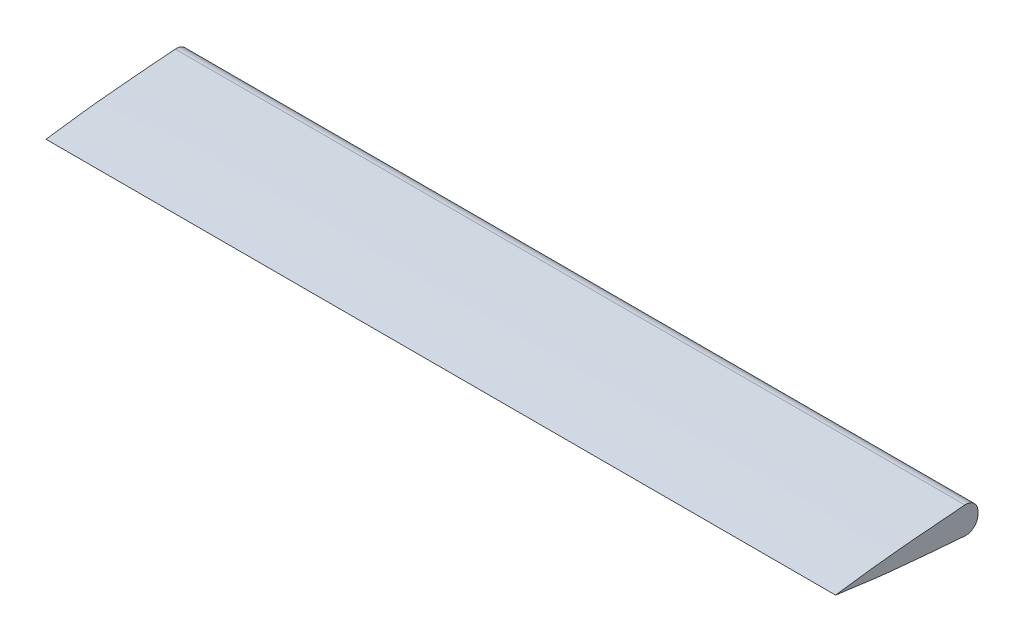
from build123d import *
from OCP.BRepAlgoAPI import BRepAlgoAPI_Cut
from OCP.TopTools import TopTools_ListOfShape

# Parameters (mm, degrees)
BOSS_EXTRUDE1_DEPTH = 95
SKETCH3_W           = 12
SKETCH3_H           = 12
CUT_EXTRUDE1_DEPTH  = 102.296476593
BOSS_EXTRUDE2_DEPTH = 2
BOSS_EXTRUDE3_START = 2
BOSS_EXTRUDE3_DEPTH = 2


with BuildPart() as part:
    # Sketch2 → Boss-Extrude1 (new, symmetric)
    with BuildSketch(Plane(origin=(0, 0, 0), x_dir=(0, 0, -1), z_dir=(1, 0, 0))):
        with BuildLine():
            Line((0, -2.242215503), (0, -1.62243157))
            ThreePointArc((0, -1.62243157), (-0.959010255, 0.576286434), (-3.22290724, 1.369275695))
            add(Edge.make_bspline(
                [(-3.22290724, 1.369275695), (-3.484450114, 1.349788561), (-5.597006474, 1.191363198), (-9.559434027, 0.879068879), (-15.107714857, 0.402320573), (-20.652255562, -0.115314326), (-24.342907371, -0.519945386), (-26.918820839, -0.852957366), (-28.388126141, -1.048635875), (-30.592084094, -1.34215364), (-32.796042047, -1.635671405), (-34.265347349, -1.831349915), (-35, -1.92918917)],
                knots=[0.017271617, 0.017271617, 0.017271617, 0.017271617, 0.021477081, 0.051241567, 0.081006054, 0.110770541, 0.140535028, 0.140535028, 0.152419133, 0.164303238, 0.176187342, 0.188071447, 0.188071447, 0.188071447, 0.188071447], degree=3))
            add(Edge.make_bspline(
                [(-35, -1.92918917), (-33.160206009, -2.175574393), (-29.480508802, -2.666326476), (-23.9619553, -3.415859901), (-18.419143462, -3.95970265), (-12.8737838, -4.464773446), (-8.248852631, -4.847937782), (-5.031369521, -5.098307213), (-3.664190055, -5.201107216), (-3.222477885, -5.233954728)],
                knots=[0.811923721, 0.811923721, 0.811923721, 0.811923721, 0.841688208, 0.871452695, 0.901217182, 0.930981669, 0.960746156, 0.975628399, 0.982730813, 0.982730813, 0.982730813, 0.982730813], degree=3))
            ThreePointArc((-3.222477885, -5.233954728), (-0.958852486, -4.440787046), (0, -2.242215503))
        make_face()
    extrude(amount=BOSS_EXTRUDE1_DEPTH, both=True)


with BuildPart() as cut_extrude1_tool:
    # Sketch3 → Cut-Extrude1 (new, through all)
    with BuildSketch(Plane(origin=(0, -1.92918917, 0), x_dir=(-1, 0, 0), z_dir=(0, -1, 0))):
        with Locations((-69, -6)):
            Rectangle(SKETCH3_W, SKETCH3_H)
        with Locations((69, -6.000001505)):
            Rectangle(SKETCH3_W, SKETCH3_H)
    extrude(amount=CUT_EXTRUDE1_DEPTH)


with BuildPart() as part_1:
    add(part.part)

    # Cut-Extrude1: cut by cut_extrude1_tool, with a tolerance
    cut_extrude1_stock = TopTools_ListOfShape()
    cut_extrude1_stock.Append(part_1.part.wrapped)
    cut_extrude1_tools = TopTools_ListOfShape()
    cut_extrude1_tools.Append(cut_extrude1_tool.part.wrapped)
    cut_extrude1_cut = BRepAlgoAPI_Cut()
    cut_extrude1_cut.SetArguments(cut_extrude1_stock)
    cut_extrude1_cut.SetTools(cut_extrude1_tools)
    cut_extrude1_cut.SetFuzzyValue(0.00001)
    cut_extrude1_cut.Build()
    add(Compound.cast(cut_extrude1_cut.Shape()).solids(), mode=Mode.REPLACE)

    # Sketch4 → Boss-Extrude2 (add)
    with BuildSketch(Plane.ZY.offset(95)):
        with BuildLine():
            Line((0, -1.62243157), (0, -2.242215503))
            ThreePointArc((0, -2.242215503), (0.958852486, -4.440787046), (3.222477885, -5.233954728))
            add(Edge.make_bspline(
                [(3.222477885, -5.233954728), (3.664190055, -5.201107216), (5.031369521, -5.098307213), (8.248852631, -4.847937782), (12.8737838, -4.464773446), (18.419143462, -3.95970265), (23.9619553, -3.415859901), (29.480508802, -2.666326476), (33.160206009, -2.175574393), (35, -1.92918917)],
                knots=[0.811923721, 0.811923721, 0.811923721, 0.811923721, 0.819026135, 0.833908378, 0.863672865, 0.893437352, 0.923201839, 0.952966326, 0.982730813, 0.982730813, 0.982730813, 0.982730813], degree=3))
            add(Edge.make_bspline(
                [(35, -1.92918917), (32.796042047, -1.635671405), (29.857431443, -1.244314385), (26.918820839, -0.852957366), (24.342907371, -0.519945386), (20.652255562, -0.115314326), (15.107714857, 0.402320573), (9.559434027, 0.879068879), (5.597006474, 1.191363198), (3.484450114, 1.349788561), (3.22290724, 1.369275695)],
                knots=[0.017271617, 0.017271617, 0.017271617, 0.017271617, 0.052923931, 0.064808036, 0.064808036, 0.094572523, 0.12433701, 0.154101497, 0.183865984, 0.188071447, 0.188071447, 0.188071447, 0.188071447], degree=3))
            ThreePointArc((3.22290724, 1.369275695), (0.959010255, 0.576286434), (0, -1.62243157))
        make_face()
    extrude(amount=BOSS_EXTRUDE2_DEPTH)

    # Sketch5 → Boss-Extrude3 (add)
    with BuildSketch(Plane(origin=(95, 0, 0), x_dir=(0, 0, -1), z_dir=(1, 0, 0)).offset(BOSS_EXTRUDE3_START)):
        with BuildLine():
            Line((0, -2.242215503), (0, -1.62243157))
            ThreePointArc((0, -1.62243157), (-0.959010255, 0.576286434), (-3.22290724, 1.369275695))
            add(Edge.make_bspline(
                [(-3.22290724, 1.369275695), (-3.484450114, 1.349788561), (-5.597006474, 1.191363198), (-9.559434027, 0.879068879), (-15.107714857, 0.402320573), (-20.652255562, -0.115314326), (-24.342907371, -0.519945386), (-26.918820839, -0.852957366), (-29.857431443, -1.244314385), (-32.796042047, -1.635671405), (-35, -1.92918917)],
                knots=[0.017271617, 0.017271617, 0.017271617, 0.017271617, 0.021477081, 0.051241567, 0.081006054, 0.110770541, 0.140535028, 0.140535028, 0.152419133, 0.188071447, 0.188071447, 0.188071447, 0.188071447], degree=3))
            add(Edge.make_bspline(
                [(-35, -1.92918917), (-33.160206009, -2.175574393), (-29.480508802, -2.666326476), (-23.9619553, -3.415859901), (-18.419143462, -3.95970265), (-12.8737838, -4.464773446), (-8.248852631, -4.847937782), (-5.031369521, -5.098307213), (-3.664190055, -5.201107216), (-3.222477885, -5.233954728)],
                knots=[0.811923721, 0.811923721, 0.811923721, 0.811923721, 0.841688208, 0.871452695, 0.901217182, 0.930981669, 0.960746156, 0.975628399, 0.982730813, 0.982730813, 0.982730813, 0.982730813], degree=3))
            ThreePointArc((-3.222477885, -5.233954728), (-0.958852486, -4.440787046), (0, -2.242215503))
        make_face()
    extrude(amount=-BOSS_EXTRUDE3_DEPTH)


solid = part_1.part
